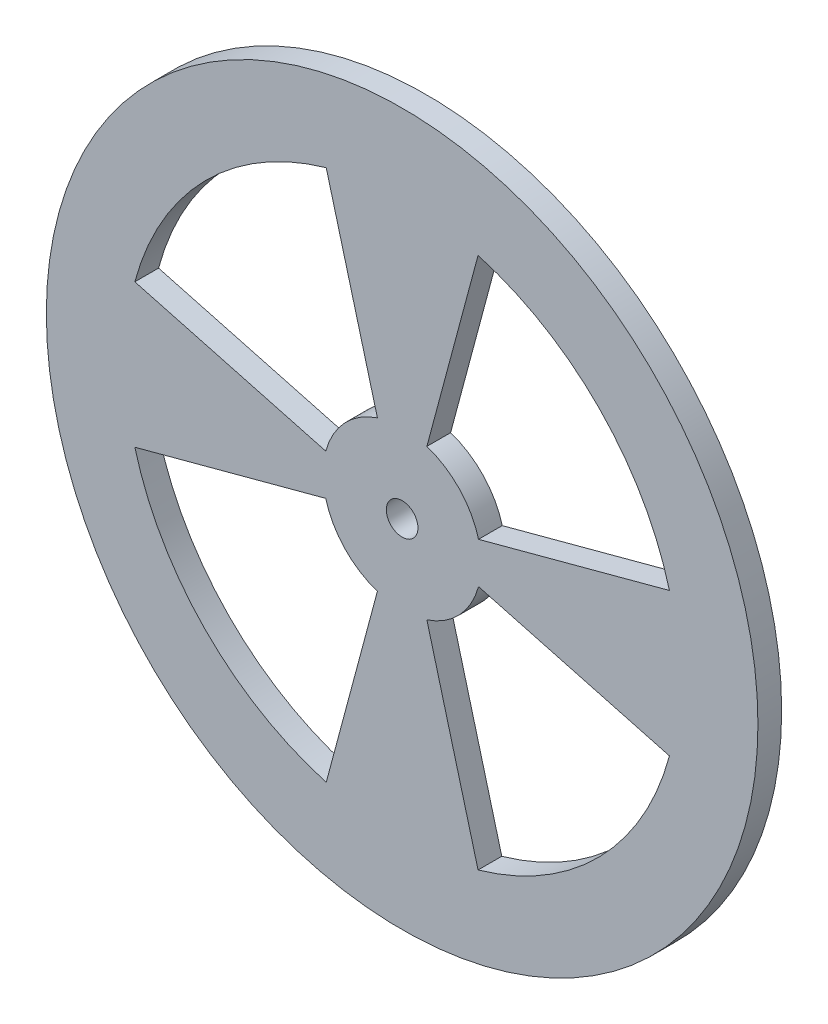
from build123d import *

# Parameters (mm, degrees)
ESQUISSE1_R        = 45
ESQUISSE1_R_2      = 2
BOSS_EXTRU_1_DEPTH = 3


with BuildPart() as part:
    # Esquisse1 → Boss.-Extru.1 (new body)
    with BuildSketch(Plane.XY):
        Circle(ESQUISSE1_R)
        with BuildLine():
            Line((3.127715259, 9.498283911), (9.601122439, 33.657368404))
            ThreePointArc((9.601122439, 33.657368404), (24.946925122, 24.54894961), (33.80740392, 9.058666579))
            Line((33.80740392, 9.058666579), (9.659258263, 2.588190451))
            ThreePointArc((9.659258263, 2.588190451), (7.267325565, 6.869205131), (3.127715259, 9.498283911))
        make_face(mode=Mode.SUBTRACT)
        with BuildLine():
            Line((-9.601122439, 33.657368404), (-3.127715259, 9.498283911))
            ThreePointArc((-3.127715259, 9.498283911), (-7.267325565, 6.869205131), (-9.659258263, 2.588190451))
            Line((-9.659258263, 2.588190451), (-33.80740392, 9.058666579))
            ThreePointArc((-33.80740392, 9.058666579), (-24.946925122, 24.54894961), (-9.601122439, 33.657368404))
        make_face(mode=Mode.SUBTRACT)
        with BuildLine():
            ThreePointArc((-9.601122439, -33.657368404), (-24.946925122, -24.54894961), (-33.80740392, -9.058666579))
            Line((-33.80740392, -9.058666579), (-9.659258263, -2.588190451))
            ThreePointArc((-9.659258263, -2.588190451), (-7.267325565, -6.869205131), (-3.127715259, -9.498283911))
            Line((-3.127715259, -9.498283911), (-9.601122439, -33.657368404))
        make_face(mode=Mode.SUBTRACT)
        with BuildLine():
            ThreePointArc((33.80740392, -9.058666579), (24.946925122, -24.54894961), (9.601122439, -33.657368404))
            Line((9.601122439, -33.657368404), (3.127715259, -9.498283911))
            ThreePointArc((3.127715259, -9.498283911), (7.267325565, -6.869205131), (9.659258263, -2.588190451))
            Line((9.659258263, -2.588190451), (33.80740392, -9.058666579))
        make_face(mode=Mode.SUBTRACT)
        Circle(ESQUISSE1_R_2, mode=Mode.SUBTRACT)
    extrude(amount=BOSS_EXTRU_1_DEPTH)


solid = part.part
